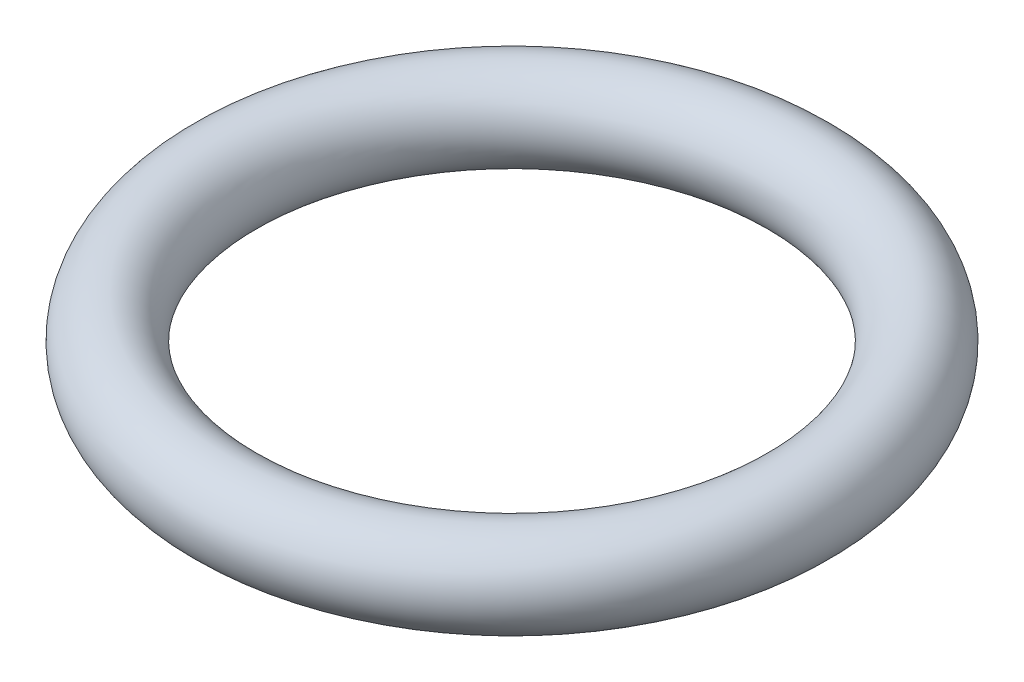
from build123d import *

# Parameters (mm, degrees)
SKETCH2_R = 0.625


with BuildPart() as part:
    # Sweep1: sweep along a path in Sketch1
    with BuildLine(Plane(origin=(0, 0, 0), x_dir=(1, 0, 0), z_dir=(0, 1, 0))) as sweep1_path:
        CenterArc((0, 0), 4.125, 0, 360)
    # Sketch2 → Sweep1 (sweep)
    with BuildSketch(Plane(origin=(0, 0, 0), x_dir=(0, 0, -1), z_dir=(1, 0, 0))):
        with Locations((-4.125, 0)):
            Circle(SKETCH2_R)
    sweep(path=sweep1_path.line)


solid = part.part
